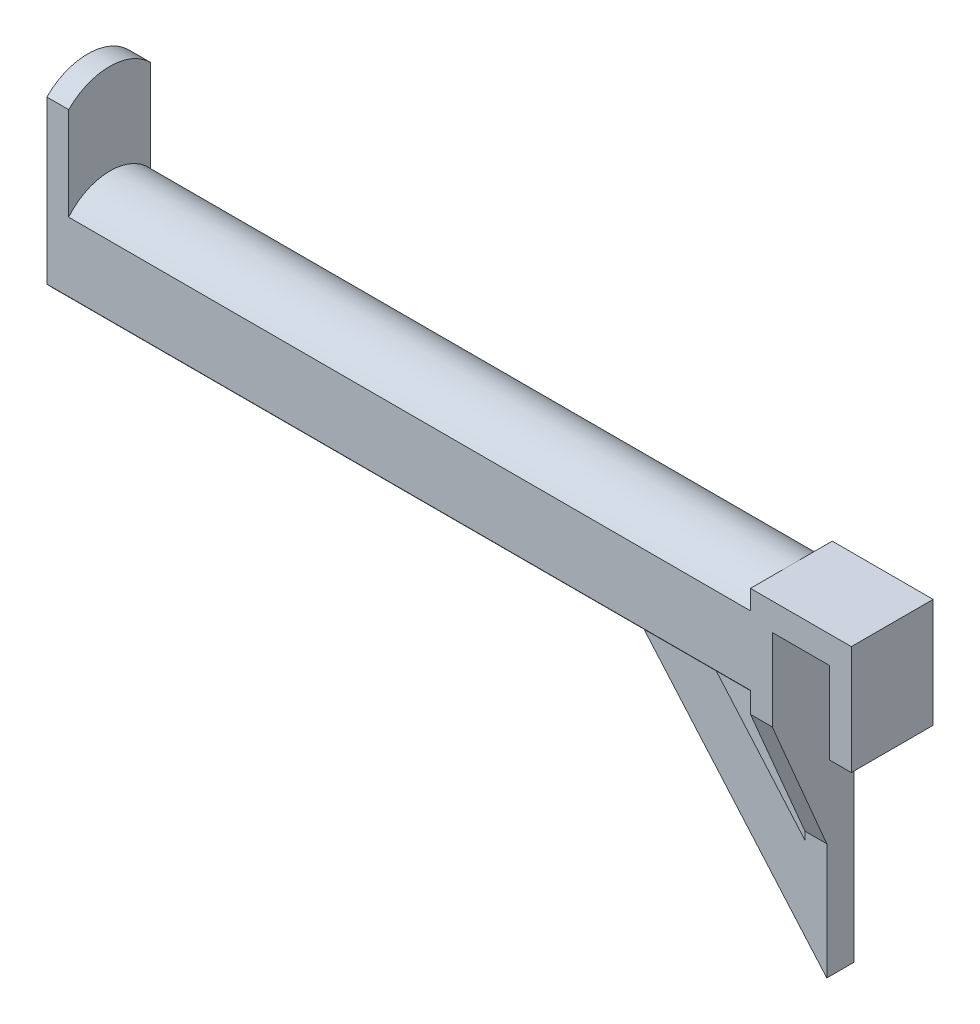
from build123d import *

# Parameters (mm, degrees)
BOSS_EXTRUDE1_DEPTH = 30
BOSS_EXTRUDE2_DEPTH = 250
BOSS_EXTRUDE3_DEPTH = 8
BOSS_EXTRUDE4_DEPTH = 10
CHAMFER1_SIZE2      = 47.117047316
CHAMFER1_SIZE       = 20


with BuildPart() as part:
    # Sketch1 → Boss-Extrude1 (new body)
    with BuildSketch(Plane.XY):
        Polygon((0, 0), (21, 0), (21, -30), (29, -30), (29, 10), (-8, 10), (-8, -30), (0, -30), align=None)
    extrude(amount=BOSS_EXTRUDE1_DEPTH)

    # Sketch2 → Boss-Extrude2 (add)
    with BuildSketch(Plane.ZY.offset(8)):
        with BuildLine():
            Line((0, -22.811969958), (0, 3.313687916))
            ThreePointArc((0, 3.313687916), (15.101138891, 9.997881194), (30, 2.874204248))
            Line((30, 2.874204248), (30, -22.37248629))
            ThreePointArc((30, -22.37248629), (15.101138891, -29.496163235), (0, -22.811969958))
        make_face()
    extrude(amount=BOSS_EXTRUDE2_DEPTH)

    # Sketch3 → Boss-Extrude3 (add)
    with BuildSketch(Plane.ZY.offset(258)):
        with BuildLine():
            Line((30, -22.37248629), (30, 37.034794094))
            ThreePointArc((30, 37.034794094), (15, 43.247997529), (0, 37.034794094))
            Line((0, 37.034794094), (0, -22.811969958))
            ThreePointArc((0, -22.811969958), (15.101138891, -29.496163235), (30, -22.37248629))
        make_face()
    extrude(amount=BOSS_EXTRUDE3_DEPTH)

    # Sketch4 → Boss-Extrude4 (add)
    with BuildSketch(Plane.XY):
        Polygon((-84.478678947, -22.37248629), (0, -119.738410874), (0, -30), (-8, -30), (-8, -80), (-58, -22.37248629), align=None)
    extrude(amount=BOSS_EXTRUDE4_DEPTH)

    # Chamfer1
    chamfer1_edges = [part.edges().sort_by_distance(p)[0] for p in [
        (-4, -30, 10),
    ]]
    chamfer1_side = [part.faces().sort_by_distance(p)[0] for p in [
        (-4, -30, 10.4),
    ]]
    chamfer(chamfer1_edges, length=CHAMFER1_SIZE - 0.0001, length2=CHAMFER1_SIZE2 - 0.0001, reference=chamfer1_side[0])  # a hair under: the kernel refuses the full size


solid = part.part
